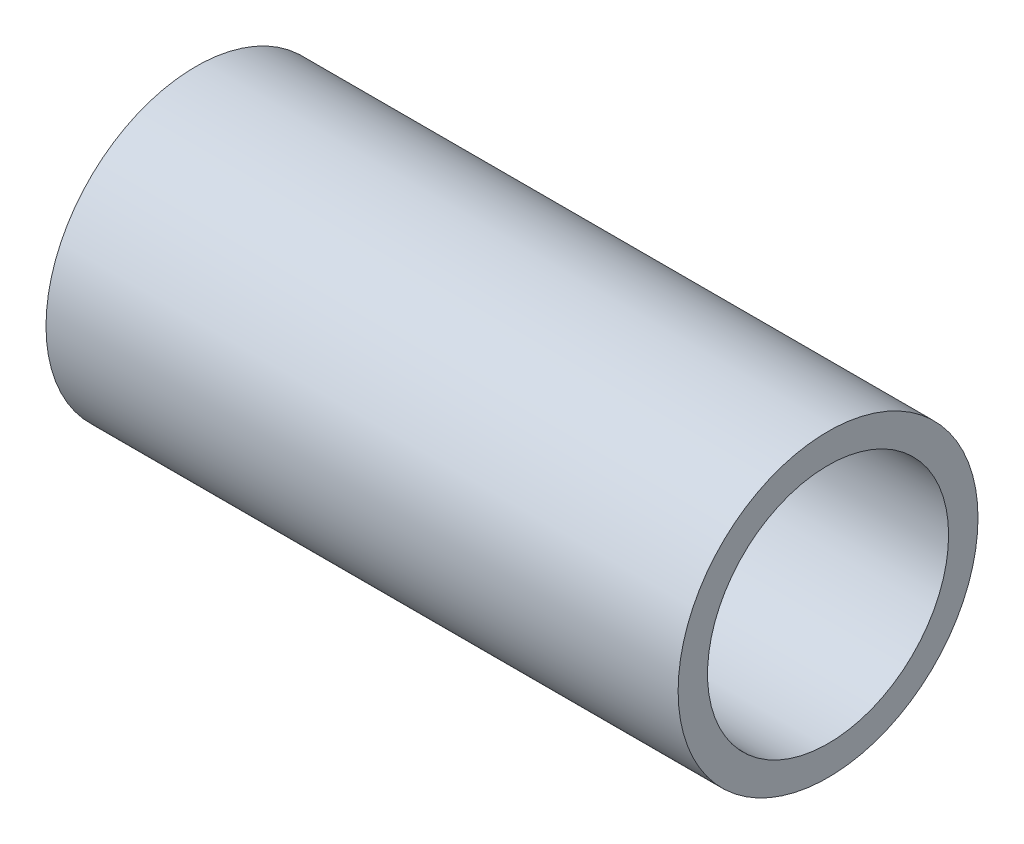
from build123d import *

# Parameters (mm, degrees)
SKIZZE1_R                       = 2.55
SKIZZE1_R_2                     = 2.05
AUFSATZ_LINEAR_AUSTRAGEN1_DEPTH = 10.75


with BuildPart() as part:
    # Skizze1 → Aufsatz-Linear austragen1 (new body)
    with BuildSketch(Plane(origin=(0, 0, 0), x_dir=(0, 0, -1), z_dir=(1, 0, 0))):
        Circle(SKIZZE1_R)
        Circle(SKIZZE1_R_2, mode=Mode.SUBTRACT)
    extrude(amount=AUFSATZ_LINEAR_AUSTRAGEN1_DEPTH)


solid = part.part
